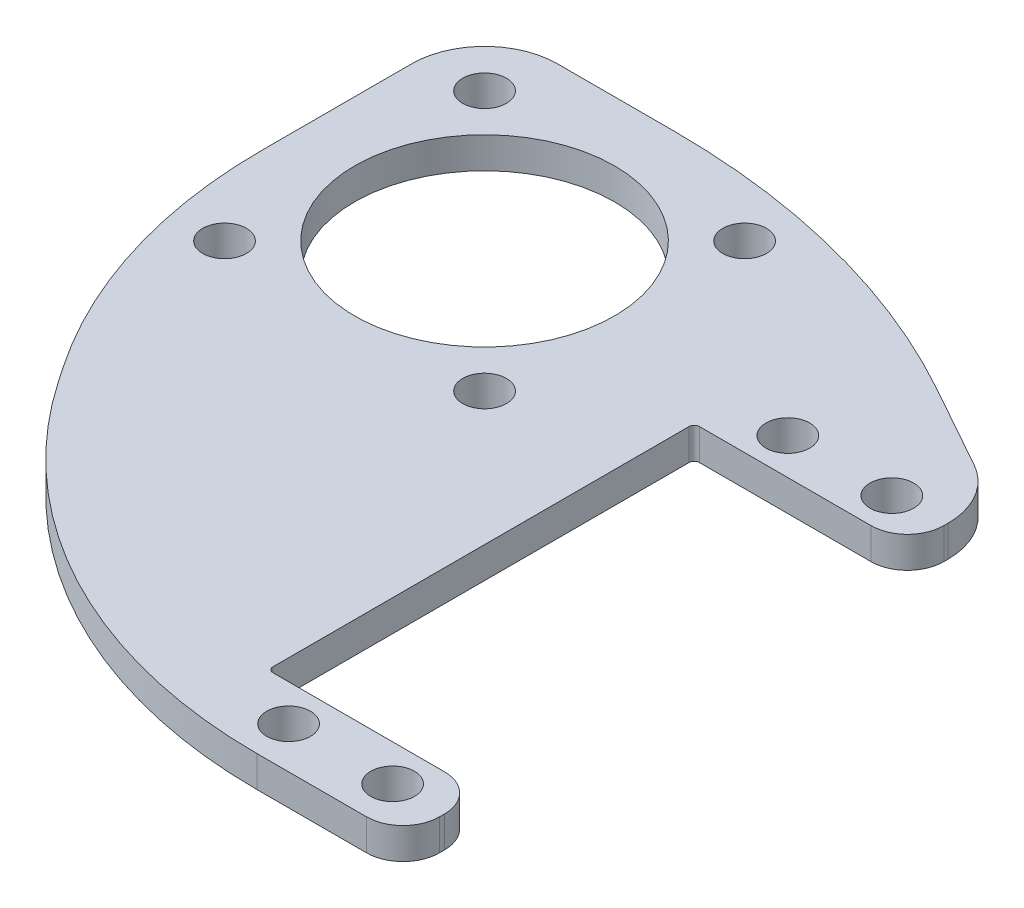
from build123d import *

# Parameters (mm, degrees)
SZKIC1_R                   = 2.1
SZKIC1_R_2                 = 12.5
WYCI_GNI_CIE_PROSTE1_DEPTH = 3
ZAOKR_GLENIE1_R            = 0.5
ZAOKR_GLENIE3_R            = 3.5
ZAOKR_GLENIE4_R            = 7
ZAOKR_GLENIE5_R            = 70
ZAOKR_GLENIE6_R            = 49
ZAOKR_GLENIE7_R            = 49
ZAOKR_GLENIE8_R            = 7


with BuildPart() as part:
    # Szkic1 → Wyciągnięcie proste1 (new body)
    with BuildSketch(Plane(origin=(0, 0, 0), x_dir=(-1, 0, 0), z_dir=(0, 1, 0))):
        Polygon((18.25, -18.25), (18.25, 18.25), (-5.78812344, 53.629485271), (-35.78812344, 53.629485271), (-45.78812344, 53.629485271), (-45.78812344, 46.129485271), (-25.28812344, 46.129485271), (-25.28812344, 5.129485271), (-45.78812344, 5.129485271), (-45.78812344, -2.870514729), (-18.25, -18.25), align=None)
        with Locations((-40.78812344, 1.629485271)):
            Circle(SZKIC1_R, mode=Mode.SUBTRACT)
        with Locations((-30.78812344, 1.629485271)):
            Circle(SZKIC1_R, mode=Mode.SUBTRACT)
        with Locations((-12.5, -12.5)):
            Circle(SZKIC1_R, mode=Mode.SUBTRACT)
        with Locations((12.5, -12.5)):
            Circle(SZKIC1_R, mode=Mode.SUBTRACT)
        Circle(SZKIC1_R_2, mode=Mode.SUBTRACT)
        with Locations((-12.5, 12.5)):
            Circle(SZKIC1_R, mode=Mode.SUBTRACT)
        with Locations((12.5, 12.5)):
            Circle(SZKIC1_R, mode=Mode.SUBTRACT)
        with Locations((-40.78812344, 49.629485271)):
            Circle(SZKIC1_R, mode=Mode.SUBTRACT)
        with Locations((-30.78812344, 49.629485271)):
            Circle(SZKIC1_R, mode=Mode.SUBTRACT)
    extrude(amount=WYCI_GNI_CIE_PROSTE1_DEPTH)

    # Zaokrąglenie1
    zaokr_glenie1_edges = [part.edges().sort_by_distance(p)[0] for p in [
        (25.28812344, 1.5, 46.129485271),
        (25.28812344, 1.5, 5.129485271),
    ]]
    fillet(zaokr_glenie1_edges, radius=ZAOKR_GLENIE1_R)

    # Zaokrąglenie3
    zaokr_glenie3_edges = [part.edges().sort_by_distance(p)[0] for p in [
        (45.78812344, 1.5, 53.629485271),
        (45.78812344, 1.5, 46.129485271),
        (45.78812344, 1.5, 5.129485271),
    ]]
    fillet(zaokr_glenie3_edges, radius=ZAOKR_GLENIE3_R)

    # Zaokrąglenie4
    zaokr_glenie4_edges = [part.edges().sort_by_distance(p)[0] for p in [
        (45.78812344, 1.5, -2.870514729),
    ]]
    fillet(zaokr_glenie4_edges, radius=ZAOKR_GLENIE4_R)

    # Zaokrąglenie5
    zaokr_glenie5_edges = [part.edges().sort_by_distance(p)[0] for p in [
        (18.25, 1.5, -18.25),
    ]]
    fillet(zaokr_glenie5_edges, radius=ZAOKR_GLENIE5_R)

    # Zaokrąglenie6
    zaokr_glenie6_edges = [part.edges().sort_by_distance(p)[0] for p in [
        (5.78812344, 1.5, 53.629485271),
    ]]
    fillet(zaokr_glenie6_edges, radius=ZAOKR_GLENIE6_R)

    # Zaokrąglenie7
    zaokr_glenie7_edges = [part.edges().sort_by_distance(p)[0] for p in [
        (-18.25, 1.5, 18.25),
    ]]
    fillet(zaokr_glenie7_edges, radius=ZAOKR_GLENIE7_R)

    # Zaokrąglenie8
    zaokr_glenie8_edges = [part.edges().sort_by_distance(p)[0] for p in [
        (-18.25, 1.5, -18.25),
    ]]
    fillet(zaokr_glenie8_edges, radius=ZAOKR_GLENIE8_R)


solid = part.part
